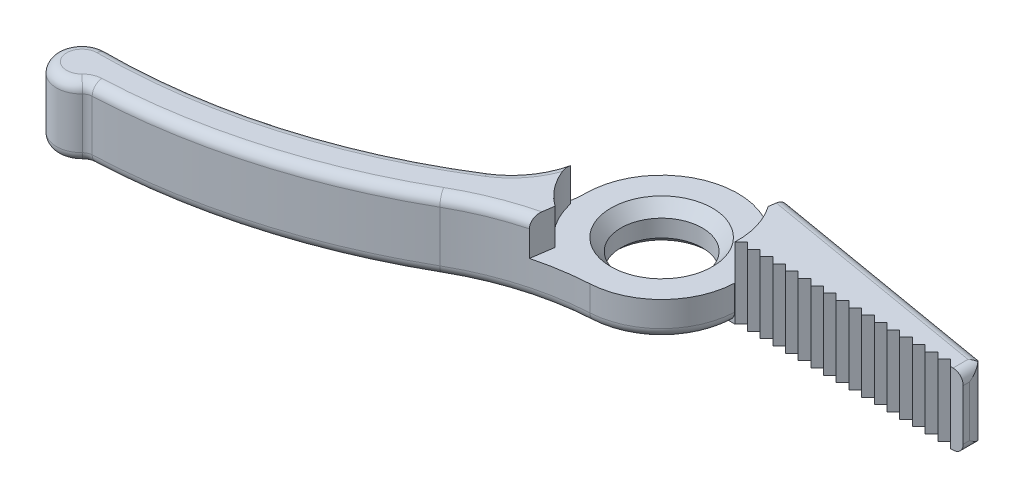
from build123d import *

# Parameters (mm, degrees)
SKETCH1_R               = 5.08
EXTRUDE1_DEPTH          = 8.89
FILLET3_R               = 33.02
CUT_EXTRUDE1_START      = -4.4704
CUT_EXTRUDE1_DEPTH      = 4.4704
FILLET4_R               = 1.27
FILLET7_R               = 1.27
FILLET8_R               = 2.54
CUT_EXTRUDE4_START      = -2.4323391
CUT_EXTRUDE4_DEPTH      = 2.4323391
SKETCH7_R               = 9.5504
CUT_EXTRUDE5_DEPTH      = 127.908284031
CHAMFER1_SIZE           = 0.762
CHAMFER2_SIZE           = 1.27
CHAMFER2_SIZE2          = 1.513527063
CUT_EXTRUDE7_DEPTH      = 128.140710162
CUT_EXTRUDE7_DEPTH_BACK = 128.140710162


# Read off the part's stored shape, not the designer's step: Cut-Extrude4
with BuildPart() as part:
    # Sketch1 → Extrude1 (new body)
    with BuildSketch(Plane(origin=(0, 0, 0), x_dir=(1, 0, 0), z_dir=(0, 1, 0))):
        with BuildLine():
            Line((12.7, -74.068815454), (12.7, -71.528815454))
            Line((12.7, -71.528815454), (-19.839666339, -65.95654879))
            ThreePointArc((-19.839666339, -65.95654879), (-20.542938147, -65.783746069), (-21.214492201, -65.512697791))
            ThreePointArc((-21.214492201, -65.512697791), (-28.50851165, -65.065328333), (-33.972800967, -69.917585685))
            ThreePointArc((-33.972800967, -69.917585685), (-34.683898809, -71.939297222), (-34.925, -74.068815454))
            ThreePointArc((-34.925, -74.068815454), (-36.075887863, -78.537283812), (-39.242168201, -81.893832809))
            ThreePointArc((-39.242168201, -81.893832809), (-56.965393588, -89.848120853), (-76.2, -92.570864422))
            ThreePointArc((-76.2, -92.570864422), (-79.027338631, -97.190434), (-73.627220553, -97.606356539))
            ThreePointArc((-73.627220553, -97.606356539), (-50.892740286, -93.213306405), (-30.610706836, -82.042155988))
            ThreePointArc((-30.610706836, -82.042155988), (-21.042688621, -82.538730598), (-15.883271821, -74.465690454))
            Line((-15.883271821, -74.465690454), (12.7, -74.465690454))
            Line((12.7, -74.465690454), (12.7, -74.068815454))
        make_face()
        with Locations(Location((-25.4, -74.068815454, 0), (0, 0, 270))):
            Circle(SKETCH1_R, mode=Mode.SUBTRACT)
    extrude(amount=EXTRUDE1_DEPTH)

    # Fillet3
    fillet3_edges = [part.edges().sort_by_distance(p)[0] for p in [
        (-30.610706836, 4.445, 82.042155988),
    ]]
    fillet(fillet3_edges, radius=FILLET3_R)

    # Sketch4 → Cut-Extrude1 (cut)
    with BuildSketch(Plane(origin=(0, 8.89, 0), x_dir=(-1, 0, 0), z_dir=(0, 1, 0)).offset(CUT_EXTRUDE1_START)):
        with BuildLine():
            Line((17.299976936, 66.391458799), (17.620638494, 68.572711419))
            ThreePointArc((17.620638494, 68.572711419), (16.819560669, 78.20423392), (24.852605063, 83.578073247))
            Line((24.852605063, 83.578073247), (24.852605063, 89.837842614))
            Line((24.852605063, 89.837842614), (32.15380679, 89.837842614))
            Line((32.15380679, 89.837842614), (30.971364696, 81.794455907))
            ThreePointArc((30.971364696, 81.794455907), (33.355442096, 79.306808013), (34.698482461, 76.13372439))
            Line((34.698482461, 76.13372439), (35.179826108, 76.225066607))
            Line((35.179826108, 76.225066607), (37.134154695, 72.138642589))
            Line((37.134154695, 72.138642589), (28.798402731, 58.612170247))
            Line((28.798402731, 58.612170247), (17.299976936, 66.391458799))
        make_face()
    extrude(amount=CUT_EXTRUDE1_DEPTH, mode=Mode.SUBTRACT)

    # Fillet4
    fillet4_edges = [part.edges().sort_by_distance(p)[0] for p in [
        (-56.965393588, 8.89, 89.848120853),
        (-56.965393588, 0, 89.848120853),
        (-79.027338631, 8.89, 97.190434),
        (-79.027338631, 0, 97.190434),
        (-35.461557578, 8.89, 85.983630351),
        (-18.611736336, 0, 80.750514447),
        (-32.337042326, 0, 84.884424071),
        (-73.627220553, 4.445, 97.606356539),
        (-55.883733715, 8.89, 94.822561219),
        (-55.883733715, 0, 94.822561219),
        (-3.569833169, 0, 68.742682122),
        (-30.442750401, 0, 65.988203262),
        (-36.656296279, 8.89, 79.456958555),
        (-36.075887863, 0, 78.537283812),
        (-20.542938147, 0, 65.783746069),
    ]]
    fillet(fillet4_edges, radius=FILLET4_R)

    # Fillet7
    fillet7_edges = [part.edges().sort_by_distance(p)[0] for p in [
        (-2.299988468, 8.89, 68.960137126),
    ]]
    fillet(fillet7_edges, radius=FILLET7_R)

    # Fillet8
    # the kernel refuses this fillet: 2.54 mm, written as the material it takes off along each edge
    with BuildSketch(Plane(origin=(12.7, -4.085026029, 71.528815454), x_dir=(-0.9856523135338612, 0, -0.1687883788219644), z_dir=(0, 1, 0))) as fillet8_piece_1:
        with BuildLine():
            CenterArc((FILLET8_R * 0.843311185663, FILLET8_R), FILLET8_R, 189.717380318, 80.282619682)
            Line((-FILLET8_R * 0.142341127871, FILLET8_R * 0.831211621178), (0, 0))
            Line((0, 0), (FILLET8_R * 0.843311185663, 0))
        make_face()
    extrude(amount=17.060052058, mode=Mode.SUBTRACT)

    # Cut-Extrude4 outline → Cut-Extrude4 (cut)
    with BuildSketch(Plane.XY.offset(74.465690454).offset(CUT_EXTRUDE4_START)):
        with BuildLine():
            Line((12.7, 0), (12.7, 1.27))
            ThreePointArc((12.7, 1.27), (12.328025612, 0.371974388), (11.43, 0))
            Line((11.43, 0), (12.7, 0))
        make_face()
        with BuildLine():
            ThreePointArc((11.43, 8.89), (12.328025612, 8.518025612), (12.7, 7.62))
            Line((12.7, 7.62), (12.7, 8.89))
            Line((12.7, 8.89), (11.43, 8.89))
        make_face()
    extrude(amount=CUT_EXTRUDE4_DEPTH, mode=Mode.SUBTRACT)

    # Sketch7 → Cut-Extrude5 (cut, through all)
    with BuildSketch(Plane(origin=(0, 4.4196, 0), x_dir=(-1, 0, 0), z_dir=(0, 1, 0))):
        with Locations((25.4, 74.068815454)):
            Circle(SKETCH7_R)
    extrude(amount=CUT_EXTRUDE5_DEPTH, mode=Mode.SUBTRACT)

    # Chamfer1
    chamfer1_edges = [part.edges().sort_by_distance(p)[0] for p in [
        (-25.4, 0, 68.988815454),
    ]]
    chamfer(chamfer1_edges, length=CHAMFER1_SIZE)

    # Chamfer2
    chamfer2_edges = [part.edges().sort_by_distance(p)[0] for p in [
        (-25.4, 4.4196, 68.988815454),
    ]]
    chamfer2_side = [part.faces().sort_by_distance(p)[0] for p in [
        (-18.616859876, 4.4196, 66.448687097),
    ]]
    chamfer(chamfer2_edges, length=CHAMFER2_SIZE, length2=CHAMFER2_SIZE2, reference=chamfer2_side[0])

    # Sketch9 → Cut-Extrude7 (cut, two sides: drawn at the far end of the back side and taken through both)
    with BuildSketch(Plane(origin=(0, 8.89, 0), x_dir=(-1, 0, 0), z_dir=(0, 1, 0)).offset(-CUT_EXTRUDE7_DEPTH_BACK)):
        Polygon((0.79375, 73.671940454), (1.5875, 74.465690454), (0, 74.465690454), align=None)
        Polygon((2.38125, 73.671940454), (3.175, 74.465690454), (1.5875, 74.465690454), align=None)
        Polygon((3.96875, 73.671940454), (4.7625, 74.465690454), (3.175, 74.465690454), align=None)
        Polygon((11.90625, 73.671940454), (12.7, 74.465690454), (11.1125, 74.465690454), align=None)
        Polygon((13.485174901, 73.680515552), (14.270349802, 74.465690454), (12.7, 74.465690454), align=None)
        Polygon((10.31875, 73.671940454), (11.1125, 74.465690454), (9.525, 74.465690454), align=None)
        Polygon((8.73125, 73.671940454), (9.525, 74.465690454), (7.9375, 74.465690454), align=None)
        Polygon((7.14375, 73.671940454), (7.9375, 74.465690454), (6.35, 74.465690454), align=None)
        Polygon((5.55625, 73.671940454), (6.35, 74.465690454), (4.7625, 74.465690454), align=None)
        Polygon((15.064099802, 73.671940454), (15.857849802, 74.465690454), (14.270349802, 74.465690454), align=None)
        Polygon((-0.79375, 73.671940454), (0, 74.465690454), (-1.5875, 74.465690454), align=None)
        Polygon((-2.38125, 73.671940454), (-1.5875, 74.465690454), (-3.175, 74.465690454), align=None)
        Polygon((-3.96875, 73.671940454), (-3.175, 74.465690454), (-4.7625, 74.465690454), align=None)
        Polygon((-5.55625, 73.671940454), (-4.7625, 74.465690454), (-6.35, 74.465690454), align=None)
        Polygon((-7.14375, 73.671940454), (-6.35, 74.465690454), (-7.9375, 74.465690454), align=None)
        Polygon((-8.73125, 73.671940454), (-7.9375, 74.465690454), (-9.525, 74.465690454), align=None)
        Polygon((-10.31875, 73.671940454), (-9.525, 74.465690454), (-11.1125, 74.465690454), align=None)
    extrude(amount=CUT_EXTRUDE7_DEPTH + CUT_EXTRUDE7_DEPTH_BACK, mode=Mode.SUBTRACT)


solid = part.part
